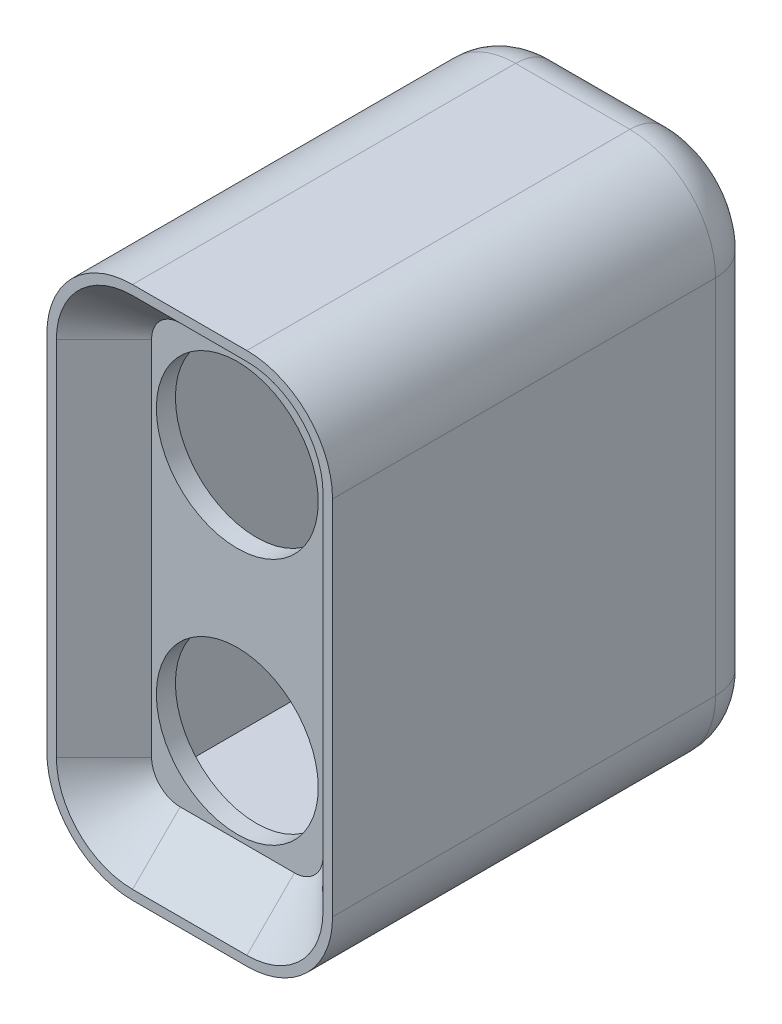
from build123d import *

# Parameters (mm, degrees)
SKETCH1_W           = 30
SKETCH1_H           = 56
SKETCH1_W_2         = 18
SKETCH1_H_2         = 51
SKETCH1_R           = 8.5
BOSS_EXTRUDE1_DEPTH = 2
SKETCH2_W           = 30
SKETCH2_H           = 56
SKETCH2_W_2         = 18
SKETCH2_H_2         = 44
BOSS_EXTRUDE2_DEPTH = 5
FILLET1_R           = 9
FILLET3_R           = 3
CHAMFER3_SIZE       = 5
SKETCH4_W           = 22.39143934
SKETCH4_H           = 45.199999578
BOSS_EXTRUDE3_DEPTH = 38.218999496
SKETCH5_W           = 15.39
SKETCH5_H           = 13.400000422
BOSS_EXTRUDE4_DEPTH = 2.6
FILLET4_R           = 5


with BuildPart() as part:
    # Sketch1 → Boss-Extrude1 (new body)
    # profile 1 of 2: a face of its own
    with BuildSketch(Plane.XY):
        with Locations((1.276e-06, 13.160000211)):
            Rectangle(SKETCH1_W, SKETCH1_H)
        with Locations((1.276e-06, 13.160000211)):
            Rectangle(SKETCH1_W_2, SKETCH1_H_2, mode=Mode.SUBTRACT)
    # profile 2 of 2: a face of its own
    with BuildSketch(Plane.XY):
        with Locations((1.276e-06, 13.160000211)):
            Rectangle(SKETCH1_W_2, SKETCH1_H_2)
        with Locations((1.276e-06, 26.160000211)):
            Circle(SKETCH1_R, mode=Mode.SUBTRACT)
        with Locations((1.276e-06, 0.160000211)):
            Circle(SKETCH1_R, mode=Mode.SUBTRACT)
    extrude(amount=-BOSS_EXTRUDE1_DEPTH)

    # Sketch2 → Boss-Extrude2 (add)
    with BuildSketch(Plane.XY):
        with Locations((1.276e-06, 13.160000211)):
            Rectangle(SKETCH2_W, SKETCH2_H)
        with Locations((1.276e-06, 13.160000211)):
            Rectangle(SKETCH2_W_2, SKETCH2_H_2, mode=Mode.SUBTRACT)
    extrude(amount=BOSS_EXTRUDE2_DEPTH)

    # Fillet1
    fillet1_edges = [part.edges().sort_by_distance(p)[0] for p in [
        (-14.999998724, -14.839999789, 1.5),
        (-14.999998724, 41.160000211, 1.5),
        (15.000001276, 41.160000211, 1.5),
        (15.000001276, -14.839999789, 1.5),
    ]]
    fillet(fillet1_edges, radius=FILLET1_R)

    # Fillet3
    fillet3_edges = [part.edges().sort_by_distance(p)[0] for p in [
        (-8.999998724, -8.839999789, 2.5),
        (9.000001276, -8.839999789, 2.5),
        (9.000001276, 35.160000211, 2.5),
        (-8.999998724, 35.160000211, 2.5),
    ]]
    fillet(fillet3_edges, radius=FILLET3_R)

    # Chamfer3
    chamfer3_edges = [part.edges().sort_by_distance(p)[0] for p in [
        (9.000001276, 13.160000211, 5),
        (8.121321619, 34.281320554, 5),
        (8.121321619, -7.961320133, 5),
        (-8.121319068, 34.281320554, 5),
        (-8.121319068, -7.961320133, 5),
        (-8.999998724, 13.160000211, 5),
        (1.276e-06, 35.160000211, 5),
        (1.276e-06, -8.839999789, 5),
    ]]
    chamfer(chamfer3_edges, length=CHAMFER3_SIZE - 0.0001)  # a hair under: the kernel refuses the full size

    # Sketch4 → Boss-Extrude3 (add)
    with BuildSketch(Plane(origin=(0, 0, -2), x_dir=(-1, 0, 0), z_dir=(0, 0, -1))):
        with BuildLine():
            Line((5.999998724, 41.160000211), (-6.000001276, 41.160000211))
            ThreePointArc((-6.000001276, 41.160000211), (-12.363962306, 38.523961242), (-15.000001276, 32.160000211))
            Line((-15.000001276, 32.160000211), (-15.000001276, -5.839999789))
            ThreePointArc((-15.000001276, -5.839999789), (-12.363962306, -12.20396082), (-6.000001276, -14.839999789))
            Line((-6.000001276, -14.839999789), (5.999998724, -14.839999789))
            ThreePointArc((5.999998724, -14.839999789), (12.363959755, -12.20396082), (14.999998724, -5.839999789))
            Line((14.999998724, -5.839999789), (14.999998724, 32.160000211))
            ThreePointArc((14.999998724, 32.160000211), (12.363959755, 38.523961242), (5.999998724, 41.160000211))
        make_face()
        with Locations((-0.84571967, 13.160000211)):
            Rectangle(SKETCH4_W, SKETCH4_H, mode=Mode.SUBTRACT)
    extrude(amount=BOSS_EXTRUDE3_DEPTH)

    # Sketch5 → Boss-Extrude4 (add)
    with BuildSketch(Plane(origin=(0, 0, -40.218999496), x_dir=(-1, 0, 0), z_dir=(0, 0, -1))):
        with BuildLine():
            Line((14.999998724, -5.839999789), (14.999998724, 32.160000211))
            ThreePointArc((14.999998724, 32.160000211), (12.363959755, 38.523961242), (5.999998724, 41.160000211))
            Line((5.999998724, 41.160000211), (-6.000001276, 41.160000211))
            ThreePointArc((-6.000001276, 41.160000211), (-12.363962306, 38.523961242), (-15.000001276, 32.160000211))
            Line((-15.000001276, 32.160000211), (-15.000001276, -5.839999789))
            ThreePointArc((-15.000001276, -5.839999789), (-12.363962306, -12.20396082), (-6.000001276, -14.839999789))
            Line((-6.000001276, -14.839999789), (5.999998724, -14.839999789))
            ThreePointArc((5.999998724, -14.839999789), (12.363959755, -12.20396082), (14.999998724, -5.839999789))
        make_face()
        with Locations((-1.845, 13.160000211)):
            Rectangle(SKETCH5_W, SKETCH5_H, mode=Mode.SUBTRACT)
    extrude(amount=-BOSS_EXTRUDE4_DEPTH)

    # Fillet4
    fillet4_edges = [part.edges().sort_by_distance(p)[0] for p in [
        (-14.999998724, 13.160000211, -40.218999496),
        (-12.363959755, 38.523961242, -40.218999496),
        (1.276e-06, 41.160000211, -40.218999496),
        (12.363962306, 38.523961242, -40.218999496),
        (15.000001276, 13.160000211, -40.218999496),
        (12.363962306, -12.20396082, -40.218999496),
        (1.276e-06, -14.839999789, -40.218999496),
        (-12.363959755, -12.20396082, -40.218999496),
    ]]
    fillet(fillet4_edges, radius=FILLET4_R)


solid = part.part
